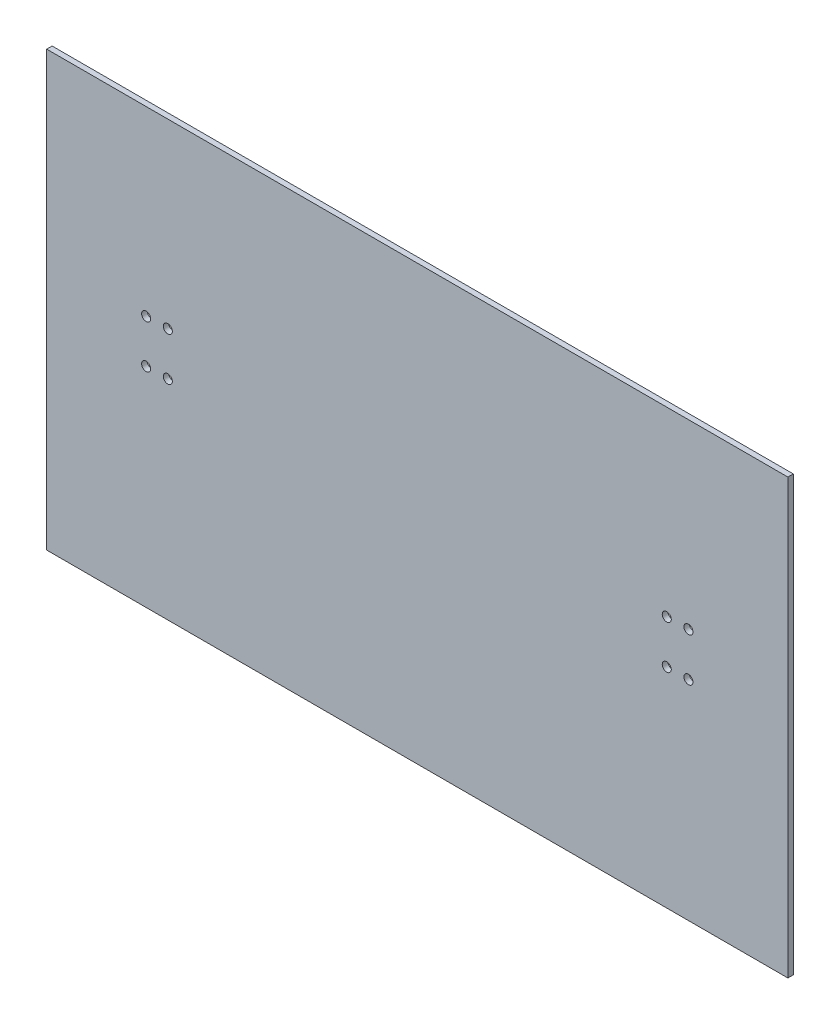
from build123d import *

# Parameters (mm, degrees)
SKETCH1_W           = 410
SKETCH1_H           = 240
BOSS_EXTRUDE1_DEPTH = 1.5
SKETCH2_R           = 2.5
CUT_EXTRUDE1_DEPTH  = 238.558413869


with BuildPart() as part:
    # Sketch1 → Boss-Extrude1 (new, symmetric)
    with BuildSketch(Plane.XY):
        Rectangle(SKETCH1_W, SKETCH1_H)
    extrude(amount=BOSS_EXTRUDE1_DEPTH, both=True)

    # Sketch2 → Cut-Extrude1 (cut, through all)
    with BuildSketch(Plane(origin=(0, 0, -1.5), x_dir=(-1, 0, 0), z_dir=(0, 0, -1))):
        with Locations((150, 19.527722998)):
            Circle(SKETCH2_R)
        with Locations((138, 19.527722998)):
            Circle(SKETCH2_R)
        with Locations((138, -4.472277002)):
            Circle(SKETCH2_R)
        with Locations((150, -4.472277002)):
            Circle(SKETCH2_R)
        with Locations((-150, 19.527722998)):
            Circle(SKETCH2_R)
        with Locations((-138, 19.527722998)):
            Circle(SKETCH2_R)
        with Locations((-138, -4.472277002)):
            Circle(SKETCH2_R)
        with Locations((-150, -4.472277002)):
            Circle(SKETCH2_R)
    extrude(amount=-CUT_EXTRUDE1_DEPTH, mode=Mode.SUBTRACT)


solid = part.part
